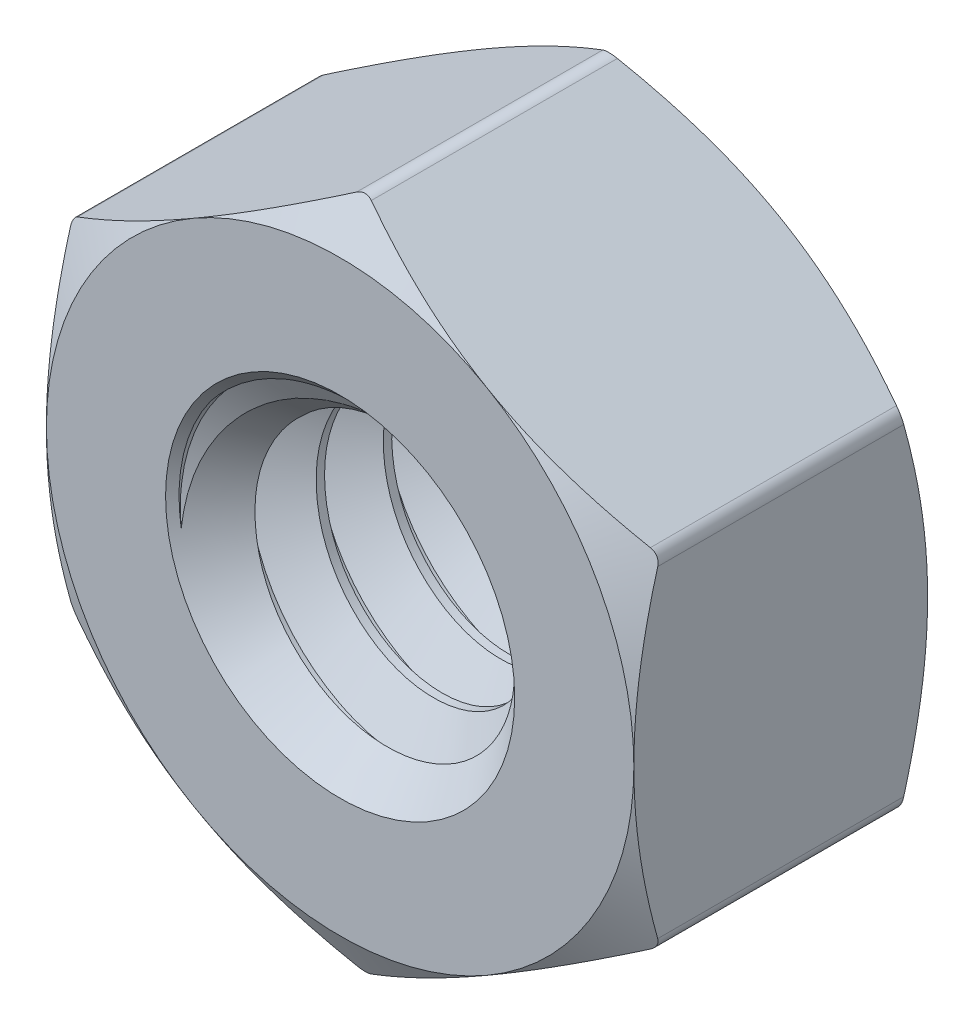
from build123d import *

# Parameters (mm, degrees)
BOSS_EXTRUDE2_DEPTH     = 2.778125
CUT_EXTRUDE4_DEPTH      = 9.930422423
CUT_EXTRUDE4_DEPTH_BACK = 9.930422423
SKETCH16_R              = 3.175
SKETCH7_OUTSIDE_W       = 55.29
SKETCH7_OUTSIDE_H       = 57.01
SKETCH7_OUTSIDE_R       = 5.55625
CUT_EXTRUDE5_DEPTH      = 11.1442782
CUT_EXTRUDE5_DRAFT      = -60
MIRROR4_COPY_1_SKETCH_W = 55.29
MIRROR4_COPY_1_SKETCH_H = 57.01
MIRROR4_COPY_1_SKETCH_R = 5.55625
MIRROR4_COPY_1_DEPTH    = 11.1442782
MIRROR4_COPY_1_DRAFT    = -60
FILLET2_R               = 0.2778125
SKETCH13_R              = 3.175
BOSS_EXTRUDE1_DEPTH     = 5.55625
CUT_SWEEP1_PITCH        = 1.27
SKETCH17_R              = 3.175
BOSS_EXTRUDE3_DEPTH     = 5.55625


with BuildPart() as part:
    # Sketch15 → Boss-Extrude2 (new, symmetric)
    with BuildSketch(Plane.XY):
        Polygon((0, 6.415804866), (-5.55625, 3.207902433), (-5.55625, -3.207902433), (0, -6.415804866), (5.55625, -3.207902433), (5.55625, 3.207902433), align=None)
    extrude(amount=BOSS_EXTRUDE2_DEPTH, both=True)

    # Sketch16 → Cut-Extrude4 (cut, two sides: drawn at the far end of the back side and taken through both)
    with BuildSketch(Plane.XY.offset(-CUT_EXTRUDE4_DEPTH_BACK)):
        Circle(SKETCH16_R)
    extrude(amount=CUT_EXTRUDE4_DEPTH + CUT_EXTRUDE4_DEPTH_BACK, mode=Mode.SUBTRACT)


with BuildPart() as cut_extrude5_tool:
    # Sketch7 outside → Cut-Extrude5 (with draft: the straight prism first)
    with BuildSketch(Plane.XY.offset(2.778125)):
        Rectangle(SKETCH7_OUTSIDE_W, SKETCH7_OUTSIDE_H)
        Circle(SKETCH7_OUTSIDE_R, mode=Mode.SUBTRACT)
    extrude(amount=-CUT_EXTRUDE5_DEPTH)
    # Cut-Extrude5: the draft: its side faces are tilted about the plane it starts from
    cut_extrude5_sides = [cut_extrude5_tool.faces().sort_by_distance(p)[0] for p in [
        (0, -28.505, -2.7940141),
        (27.645, 0, -2.7940141),
        (0, 28.505, -2.7940141),
        (-27.645, 0, -2.7940141),
        (-5.55625, 0, -2.7940141),
    ]]
    draft(cut_extrude5_sides, Plane.XY.offset(2.778125), CUT_EXTRUDE5_DRAFT)


with BuildPart() as part_1:
    add(part.part)

    # Cut-Extrude5: cut by cut_extrude5_tool
    add(cut_extrude5_tool.part, mode=Mode.SUBTRACT)


with BuildPart() as mirror4_copy_1_tool:
    # Mirror4 copy 1 sketch → Mirror4 copy 1 (with draft: the straight prism first)
    with BuildSketch(Plane(origin=(0, 0, -2.778125), x_dir=(1, 0, 0), z_dir=(0, 0, -1))):
        Rectangle(MIRROR4_COPY_1_SKETCH_W, MIRROR4_COPY_1_SKETCH_H)
        Circle(MIRROR4_COPY_1_SKETCH_R, mode=Mode.SUBTRACT)
    extrude(amount=-MIRROR4_COPY_1_DEPTH)
    # Mirror4 copy 1: the draft: its side faces are tilted about the plane it starts from
    mirror4_copy_1_sides = [mirror4_copy_1_tool.faces().sort_by_distance(p)[0] for p in [
        (0, -28.505, 2.7940141),
        (27.645, 0, 2.7940141),
        (0, 28.505, 2.7940141),
        (-27.645, 0, 2.7940141),
        (-5.55625, 0, 2.7940141),
    ]]
    draft(mirror4_copy_1_sides, Plane(origin=(0, 0, -2.778125), x_dir=(1, 0, 0), z_dir=(0, 0, -1)), MIRROR4_COPY_1_DRAFT)


with BuildPart() as part_2:
    add(part_1.part)

    # Mirror4 copy 1: cut by mirror4_copy_1_tool
    add(mirror4_copy_1_tool.part, mode=Mode.SUBTRACT)

    # Fillet2
    fillet2_edges = [part_2.edges().sort_by_distance(p)[0] for p in [
        (-5.55625, 3.207902433, 0),
        (-5.55625, -3.207902433, 0),
        (0, -6.415804866, 0),
        (5.55625, -3.207902433, 0),
        (5.55625, 3.207902433, 0),
        (0, 6.415804866, 0),
    ]]
    fillet(fillet2_edges, radius=FILLET2_R)

    # Sketch17 → Boss-Extrude3 (add)
    with BuildSketch(Plane.XY.offset(2.778125)):
        Circle(SKETCH17_R)
    extrude(amount=-BOSS_EXTRUDE3_DEPTH)


with BuildPart() as body_2:
    # Sketch13 → Boss-Extrude1 (new body)
    with BuildSketch(Plane(origin=(0, 0, -2.778125), x_dir=(-1, 0, 0), z_dir=(0, 0, -1))):
        Circle(SKETCH13_R)
    extrude(amount=-BOSS_EXTRUDE1_DEPTH)

    # Cut-Sweep1: the profile of Sketch12 profile screwed along a right-hand helix of 5.375 turns, 8 arcs to a turn; built about Z, then put on its axis
    cut_sweep1_z = Axis((0, 0, 0), (0, 0, 1))
    cut_sweep1_corners = [(3.1753, 0, -1.111423205), (3.1753, 0, 0.000173205), (2.350110803, 0, -0.47625), (2.350110803, 0, -0.635)]
    with BuildLine(mode=Mode.PRIVATE) as cut_sweep1_profile:
        Line(cut_sweep1_corners[0], cut_sweep1_corners[1])
        Line(cut_sweep1_corners[1], cut_sweep1_corners[2])
        Line(cut_sweep1_corners[2], cut_sweep1_corners[3])
        Line(cut_sweep1_corners[3], cut_sweep1_corners[0])
    cut_sweep1_cap = Face(cut_sweep1_profile.wire())
    cut_sweep1_turn_angles = [0, 22.5, 45, 67.5, 90, 112.5, 135, 157.5, 180, 202.5, 225, 247.5, 270, 292.5, 315, 337.5, 360]
    cut_sweep1_turn_weights = [1, 0.9238795325112867, 1, 0.9238795325112867, 1, 0.9238795325112867, 1, 0.9238795325112867, 1, 0.9238795325112867, 1, 0.9238795325112867, 1, 0.9238795325112867, 1, 0.9238795325112867, 1]
    cut_sweep1_turn_rails = [Edge.make_bspline([Vector(p[0], p[1], 0).rotate(cut_sweep1_z, cut_sweep1_turn_angles[k]) / cut_sweep1_turn_weights[k] + Vector(0, 0, p[2] + CUT_SWEEP1_PITCH * cut_sweep1_turn_angles[k] / 360) for k in range(17)], [0, 0, 0, 1, 1, 2, 2, 3, 3, 4, 4, 5, 5, 6, 6, 7, 7, 8, 8, 8], 2, cut_sweep1_turn_weights) for p in cut_sweep1_corners]
    cut_sweep1_turn_sides = [Face.make_surface_from_curves(cut_sweep1_turn_rails[p[0]], cut_sweep1_turn_rails[p[1]]) for p in [(0, 1), (1, 2), (2, 3), (3, 0)]]
    cut_sweep1_last_angles = [1800, 1822.5, 1845, 1867.5, 1890, 1912.5, 1935]
    cut_sweep1_last_weights = [1, 0.9238795325112867, 1, 0.9238795325112867, 1, 0.92387953251128, 1]
    cut_sweep1_last_rails = [Edge.make_bspline([Vector(p[0], p[1], 0).rotate(cut_sweep1_z, cut_sweep1_last_angles[k]) / cut_sweep1_last_weights[k] + Vector(0, 0, p[2] + CUT_SWEEP1_PITCH * cut_sweep1_last_angles[k] / 360) for k in range(7)], [0, 0, 0, 1, 1, 2, 2, 3, 3, 3], 2, cut_sweep1_last_weights) for p in cut_sweep1_corners]
    cut_sweep1_last_sides = [Face.make_surface_from_curves(cut_sweep1_last_rails[p[0]], cut_sweep1_last_rails[p[1]]) for p in [(0, 1), (1, 2), (2, 3), (3, 0)]]
    cut_sweep1 = Plane(origin=(0, 0, -2.778125), x_dir=(0, 1, 0), z_dir=(0, 0, 1)) * Solid(Shell([*[p.moved(Location((0, 0, CUT_SWEEP1_PITCH * i))) for i in range(5) for p in cut_sweep1_turn_sides], *cut_sweep1_last_sides, cut_sweep1_cap, cut_sweep1_cap.rotate(cut_sweep1_z, 1935).moved(Location((0, 0, CUT_SWEEP1_PITCH * 1935 / 360)))]))
    add(cut_sweep1, mode=Mode.SUBTRACT)


with BuildPart() as part_3:
    add(part_2.part)

    # Combine1: cut body 2
    add(body_2.part, mode=Mode.SUBTRACT)

    # Cut-Extrude2 cone 1 section (through the dimple's axis) → Cut-Extrude2 (revolve, cut)
    with BuildSketch(Plane(origin=(0, 0, 2.778125), x_dir=(0, -1, 0), z_dir=(1, 0, 0))):
        Polygon((0, 0), (3.302, 0), (0, 3.302), align=None)
    revolve(axis=Axis((0, 0, 2.778125), (0, 0, -1)), mode=Mode.SUBTRACT)

    # Cut-Extrude3 cone 1 section (through the dimple's axis) → Cut-Extrude3 (revolve, cut)
    with BuildSketch(Plane(origin=(0, 0, -2.778125), x_dir=(0, 1, 0), z_dir=(1, 0, 0))):
        Polygon((0, 0), (3.302, 0), (0, 3.302), align=None)
    revolve(axis=Axis((0, 0, -2.778125), (0, 0, 1)), mode=Mode.SUBTRACT)


solid = part_3.part
